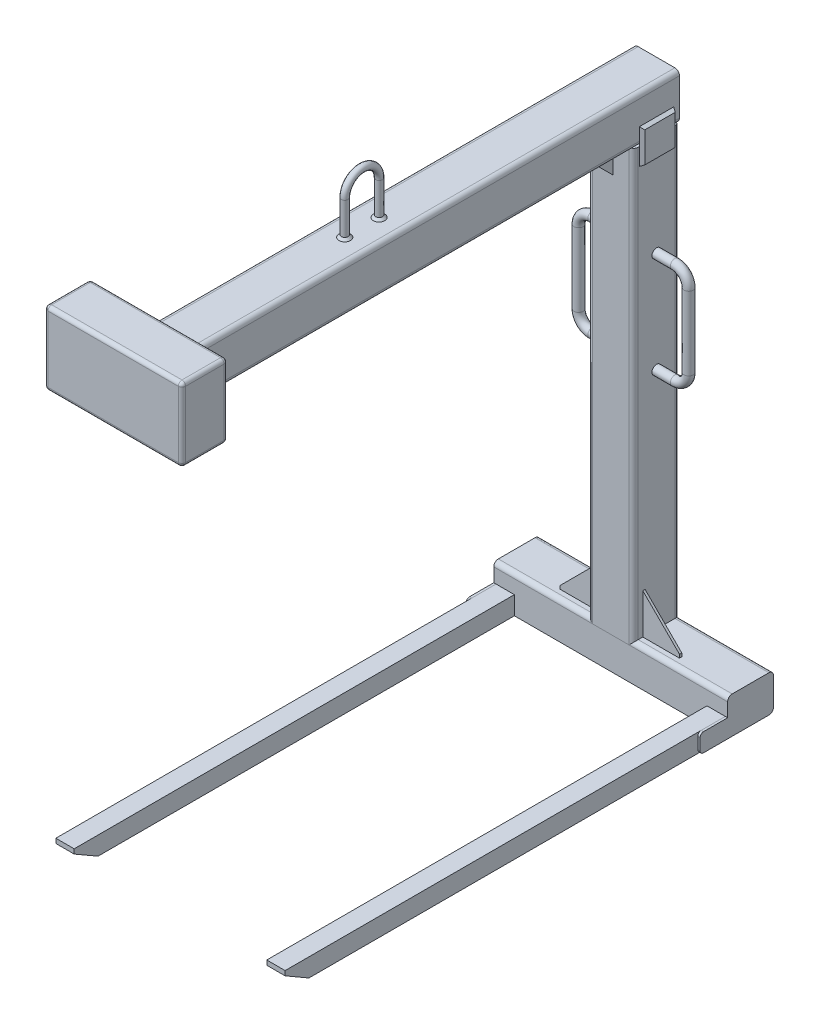
from build123d import *

# Parameters (mm, degrees)
BOSS_EXTRUDE1_DEPTH            = 50.8
BOSS_EXTRUDE2_DEPTH            = 323.85
BOSS_EXTRUDE2_DEPTH_BACK       = 323.85
BOSS_EXTRUDE3_DEPTH            = 63.5
SKETCH7_W                      = 1377.95
SKETCH7_H                      = 127
BOSS_EXTRUDE4_DEPTH            = 127
SKETCH93_W                     = 127
SKETCH93_H                     = 203.2
BOSS_EXTRUDE21_DEPTH           = 190.5
BOSS_EXTRUDE8_START            = -25.4
BOSS_EXTRUDE8_DEPTH            = 6.35
BOSS_EXTRUDE8_2_DEPTH          = 6.35
SKETCH17_W                     = 95.25
SKETCH17_H                     = 95.25
BOSS_EXTRUDE9_DEPTH            = 9.525
BOSS_EXTRUDE9_TAPER            = 30
BOSS_EXTRUDE22_DEPTH           = 6.35
FILLET1_R                      = 12.7
FILLET2_R                      = 12.7
FILLET3_R                      = 10.16
CUT_EXTRUDE2_START             = -6.35
CUT_EXTRUDE2_DEPTH             = 1728.098234192
SKETCH26_R                     = 9.525
SKETCH103_R                    = 12.7
SKETCH104_R                    = 9.525
BOSS_EXTRUDE24_DEPTH           = 6.35
BOSS_EXTRUDE24_DRAFT           = 45
BOSS_EXTRUDE24_PROFILE_2_DEPTH = 6.35
BOSS_EXTRUDE24_PROFILE_2_DRAFT = 45
SKETCH107_R                    = 15.875
CUT_EXTRUDE3_DEPTH             = 1661.707112385
BOSS_EXTRUDE26_DEPTH           = 6.35
BOSS_EXTRUDE27_DEPTH           = 6.35


# Read off the part's stored shape, not the designer's step: Boss-Extrude25
with BuildPart() as part:
    # Sketch3 → Boss-Extrude1 (new body)
    with BuildSketch(Plane(origin=(317.5, 0, 0), x_dir=(0, 0, -1), z_dir=(1, 0, 0))):
        Polygon((-530.225, -746.125), (688.975, -746.125), (688.975, -796.925), (-464.233864232, -796.925), (-530.225, -758.825), align=None)
    extrude(amount=-BOSS_EXTRUDE1_DEPTH)


with BuildPart() as body_2:
    # Mirror3: mirrored copy
    add(part.part.mirror(Plane(origin=(0, 0, 0), x_dir=(0, 0, 1), z_dir=(1, 0, 0))))


with BuildPart() as body_3:
    # Sketch4 → Boss-Extrude2 (new, two sides: drawn at the far end of the back side and taken through both)
    with BuildSketch(Plane(origin=(0, 0, 0), x_dir=(0, 0, -1), z_dir=(1, 0, 0)).offset(-BOSS_EXTRUDE2_DEPTH_BACK)):
        with BuildLine():
            Line((688.975, -796.925), (803.275, -796.925))
            ThreePointArc((803.275, -796.925), (812.255256121, -793.205256121), (815.975, -784.225))
            Line((815.975, -784.225), (815.975, -708.025))
            ThreePointArc((815.975, -708.025), (812.255256121, -699.044743879), (803.275, -695.325))
            Line((803.275, -695.325), (701.675, -695.325))
            ThreePointArc((701.675, -695.325), (692.694743879, -699.044743879), (688.975, -708.025))
            Line((688.975, -708.025), (688.975, -796.925))
        make_face()
    extrude(amount=BOSS_EXTRUDE2_DEPTH + BOSS_EXTRUDE2_DEPTH_BACK)

    # Sketch108 → Boss-Extrude26 (add)
    with BuildSketch(Plane(origin=(323.85, 0, 0), x_dir=(0, 0, -1), z_dir=(1, 0, 0))):
        with BuildLine():
            Line((688.975, -796.925), (622.3, -796.925))
            ThreePointArc((622.3, -796.925), (615.564807909, -794.135192091), (612.775, -787.4))
            Line((612.775, -787.4), (612.775, -755.65))
            ThreePointArc((612.775, -755.65), (615.564807909, -748.914807909), (622.3, -746.125))
            Line((622.3, -746.125), (688.975, -746.125))
            Line((688.975, -746.125), (688.975, -796.925))
        make_face()
    extrude(amount=-BOSS_EXTRUDE26_DEPTH)

    # Sketch110 → Boss-Extrude27 (add)
    with BuildSketch(Plane.ZY.offset(323.85)):
        with BuildLine():
            Line((-688.975, -796.925), (-622.3, -796.925))
            ThreePointArc((-622.3, -796.925), (-615.564807909, -794.135192091), (-612.775, -787.4))
            Line((-612.775, -787.4), (-612.775, -755.65))
            ThreePointArc((-612.775, -755.65), (-615.564807909, -748.914807909), (-622.3, -746.125))
            Line((-622.3, -746.125), (-688.975, -746.125))
            Line((-688.975, -746.125), (-688.975, -796.925))
        make_face()
    extrude(amount=-BOSS_EXTRUDE27_DEPTH)


with BuildPart() as body_4:
    # Sketch6 → Boss-Extrude3 (new, symmetric)
    with BuildSketch(Plane(origin=(0, 0, 0), x_dir=(0, 0, -1), z_dir=(1, 0, 0))):
        with BuildLine():
            Line((688.975, -708.025), (688.975, 485.775))
            Line((688.975, 485.775), (815.975, 485.775))
            Line((815.975, 485.775), (815.975, -708.025))
            ThreePointArc((815.975, -708.025), (812.255256121, -699.044743879), (803.275, -695.325))
            Line((803.275, -695.325), (701.675, -695.325))
            ThreePointArc((701.675, -695.325), (692.694743879, -699.044743879), (688.975, -708.025))
        make_face()
    extrude(amount=BOSS_EXTRUDE3_DEPTH, both=True)

    # Fillet2
    fillet2_edges = [body_4.edges().sort_by_distance(p)[0] for p in [
        (-63.5, -111.125, -688.975),
        (63.5, -111.125, -688.975),
        (-63.5, -111.125, -815.975),
        (63.5, -111.125, -815.975),
    ]]
    fillet(fillet2_edges, radius=FILLET2_R)

    # Sweep3: sweep along a path in Sketch101
    with BuildLine(Plane.XY.offset(-752.475)) as sweep3_path:
        Line((-114.3, -60.325), (114.3, -60.325))
        ThreePointArc((114.3, -60.325), (132.260512242, -52.885512242), (139.7, -34.925))
        Line((139.7, -34.925), (139.7, 168.275))
        ThreePointArc((139.7, 168.275), (132.260512242, 186.235512242), (114.3, 193.675))
        Line((114.3, 193.675), (-114.3, 193.675))
        ThreePointArc((-114.3, 193.675), (-132.260512242, 186.235512242), (-139.7, 168.275))
        Line((-139.7, 168.275), (-139.7, -34.925))
        ThreePointArc((-139.7, -34.925), (-132.260512242, -52.885512242), (-114.3, -60.325))
    # Sketch103 → Sweep3 (sweep)
    with BuildSketch(Plane(origin=(0, 0, 0), x_dir=(0, 0, -1), z_dir=(1, 0, 0))):
        with Locations((752.475, 206.375)):
            Circle(SKETCH103_R)
    sweep(path=sweep3_path.line)


with BuildPart() as body_5:
    # Sketch7 → Boss-Extrude4 (new body)
    with BuildSketch(Plane(origin=(63.5, 0, 0), x_dir=(0, 0, -1), z_dir=(1, 0, 0))):
        with Locations((127, 549.275)):
            Rectangle(SKETCH7_W, SKETCH7_H)
    extrude(amount=-BOSS_EXTRUDE4_DEPTH)

    # Fillet1
    fillet1_edges = [body_5.edges().sort_by_distance(p)[0] for p in [
        (-63.5, 485.775, -127),
        (63.5, 485.775, -127),
        (63.5, 612.775, -127),
        (-63.5, 612.775, -127),
    ]]
    fillet(fillet1_edges, radius=FILLET1_R)

    # Sketch98 → Cut-Extrude2 (cut, through all)
    with BuildSketch(Plane(origin=(0, 0, -815.975), x_dir=(-1, 0, 0), z_dir=(0, 0, -1)).offset(CUT_EXTRUDE2_START)):
        with BuildLine():
            Line((-57.15, 600.075), (-57.15, 498.475))
            ThreePointArc((-57.15, 498.475), (-55.290128061, 493.984871939), (-50.8, 492.125))
            Line((-50.8, 492.125), (50.8, 492.125))
            ThreePointArc((50.8, 492.125), (55.290128061, 493.984871939), (57.15, 498.475))
            Line((57.15, 498.475), (57.15, 600.075))
            ThreePointArc((57.15, 600.075), (55.290128061, 604.565128061), (50.8, 606.425))
            Line((50.8, 606.425), (-50.8, 606.425))
            ThreePointArc((-50.8, 606.425), (-55.290128061, 604.565128061), (-57.15, 600.075))
        make_face()
    extrude(amount=-CUT_EXTRUDE2_DEPTH, mode=Mode.SUBTRACT)

    # Sketch107 → Cut-Extrude3 (cut, through all)
    with BuildSketch(Plane(origin=(0, 612.775, 0), x_dir=(1, 0, 0), z_dir=(0, 1, 0))):
        with Locations(Location((0, 47.625, 0), (0, 0, 270))):
            Circle(SKETCH107_R)
        with Locations(Location((0, -47.625, 0), (0, 0, 270))):
            Circle(SKETCH107_R)
    extrude(amount=-CUT_EXTRUDE3_DEPTH, mode=Mode.SUBTRACT)


with BuildPart() as body_6:
    # Sketch93 → Boss-Extrude21 (new, symmetric)
    with BuildSketch(Plane(origin=(0, 0, 0), x_dir=(0, 0, -1), z_dir=(1, 0, 0))):
        with Locations((-625.475, 574.675)):
            Rectangle(SKETCH93_W, SKETCH93_H)
    extrude(amount=BOSS_EXTRUDE21_DEPTH, both=True)

    # Fillet3
    fillet3_edges = [body_6.edges().sort_by_distance(p)[0] for p in [
        (-190.5, 574.675, 561.975),
        (-190.5, 676.275, 625.475),
        (-190.5, 574.675, 688.975),
        (190.5, 676.275, 625.475),
        (190.5, 574.675, 561.975),
        (190.5, 473.075, 625.475),
        (190.5, 574.675, 688.975),
        (-190.5, 473.075, 625.475),
        (0, 676.275, 688.975),
        (0, 676.275, 561.975),
        (0, 473.075, 561.975),
        (0, 473.075, 688.975),
    ]]
    fillet(fillet3_edges, radius=FILLET3_R)


with BuildPart() as body_7:
    # Sketch16 → Boss-Extrude8 (new body)
    with BuildSketch(Plane.XY.offset(-688.975).offset(BOSS_EXTRUDE8_START)):
        Polygon((165.1, -695.325), (165.1, -685.8), (63.5, -584.2), (63.5, -695.325), align=None)
    extrude(amount=-BOSS_EXTRUDE8_DEPTH)


with BuildPart() as body_8:
    # Sketch16 → Boss-Extrude8 2 (new body)
    with BuildSketch(Plane.XY.offset(-688.975).offset(BOSS_EXTRUDE8_START)):
        Polygon((-63.5, -695.325), (-165.1, -695.325), (-165.1, -685.8), (-63.5, -584.2), align=None)
    extrude(amount=-BOSS_EXTRUDE8_2_DEPTH)


with BuildPart() as body_9:
    # Sketch17 → Boss-Extrude9 (new body)
    with BuildSketch(Plane(origin=(63.5, 0, 0), x_dir=(0, 0, -1), z_dir=(1, 0, 0))):
        with Locations((752.475, 485.775)):
            Rectangle(SKETCH17_W, SKETCH17_H)
    extrude(amount=BOSS_EXTRUDE9_DEPTH, taper=BOSS_EXTRUDE9_TAPER)


with BuildPart() as body_10:
    # Mirror6: mirrored copy
    add(body_9.part.mirror(Plane(origin=(0, 0, 0), x_dir=(0, 0, 1), z_dir=(1, 0, 0))))


with BuildPart() as body_11:
    # Sketch94 → Boss-Extrude22 (new, symmetric)
    with BuildSketch(Plane(origin=(0, 0, 0), x_dir=(0, 0, -1), z_dir=(1, 0, 0))):
        Polygon((688.975, 396.875), (688.975, 485.775), (600.075, 485.775), align=None)
    extrude(amount=BOSS_EXTRUDE22_DEPTH, both=True)


with BuildPart() as body_12:
    # Sweep1: sweep along a path in Sketch99
    with BuildLine(Plane(origin=(0, 0, 0), x_dir=(0, 0, -1), z_dir=(1, 0, 0))) as sweep1_path:
        Line((38.1, 479.425), (38.1, 708.025))
        ThreePointArc((38.1, 708.025), (26.940768363, 734.965768363), (0, 746.125))
    # Sketch26 → Sweep1 (sweep)
    with BuildSketch(Plane.XY):
        with Locations((0, 755.65)):
            Circle(SKETCH26_R)
    sweep(path=sweep1_path.line)

    # Mirror7: body 12 across plane


with BuildPart() as body_12_1:
    add(body_12.part)
    add(body_12.part.mirror(Plane(origin=(0, 755.65, 0), x_dir=(1, 0, 0), z_dir=(0, 0, 1))))


with BuildPart() as boss_extrude24_tool:
    # Sketch104 → Boss-Extrude24 (with draft: the straight prism first)
    with BuildSketch(Plane.XZ.offset(-479.425)):
        with Locations(Location((0, 47.625, 0), (0, 0, 90))):
            Circle(SKETCH104_R)
    extrude(amount=-BOSS_EXTRUDE24_DEPTH)
    # Boss-Extrude24: the draft: its side faces are tilted about the plane it starts from
    boss_extrude24_sides = [boss_extrude24_tool.faces().sort_by_distance(p)[0] for p in [
        (0, 482.6, 38.1),
    ]]
    draft(boss_extrude24_sides, Plane.XZ.offset(-479.425), BOSS_EXTRUDE24_DRAFT)


with BuildPart() as body_12_2:
    add(body_12_1.part)

    # Boss-Extrude24: add boss_extrude24_tool
    add(boss_extrude24_tool.part)


with BuildPart() as boss_extrude24_profile_2_tool:
    # Sketch104 → Boss-Extrude24 profile 2 (with draft: the straight prism first)
    with BuildSketch(Plane.XZ.offset(-479.425)):
        with Locations(Location((0, -47.625, 0), (0, 0, 270))):
            Circle(SKETCH104_R)
    extrude(amount=-BOSS_EXTRUDE24_PROFILE_2_DEPTH)
    # Boss-Extrude24 profile 2: the draft: its side faces are tilted about the plane it starts from
    boss_extrude24_profile_2_sides = [boss_extrude24_profile_2_tool.faces().sort_by_distance(p)[0] for p in [
        (0, 482.6, -38.1),
    ]]
    draft(boss_extrude24_profile_2_sides, Plane.XZ.offset(-479.425), BOSS_EXTRUDE24_PROFILE_2_DRAFT)


with BuildPart() as body_12_3:
    add(body_12_2.part)

    # Boss-Extrude24 profile 2: add boss_extrude24_profile_2_tool
    add(boss_extrude24_profile_2_tool.part)

    # Boss-Extrude25 outline → Boss-Extrude25 (revolve)
    with BuildSketch(Plane.XY.offset(47.625)):
        Polygon((15.875, 612.775), (9.525, 619.125), (9.525, 485.775), (15.875, 485.775), align=None)
    revolve(axis=Axis((0, 0, 47.625), (0, 1, 0)))

    # Boss-Extrude25 2 outline → Boss-Extrude25 2 (revolve)
    with BuildSketch(Plane.XY.offset(-47.625)):
        Polygon((15.875, 612.775), (9.525, 619.125), (9.525, 485.775), (15.875, 485.775), align=None)
    revolve(axis=Axis((0, 0, -47.625), (0, 1, 0)))


solid = Compound([part.part, body_2.part, body_3.part, body_4.part, body_5.part, body_6.part, body_7.part, body_8.part, body_9.part, body_10.part, body_11.part, body_12_3.part])
